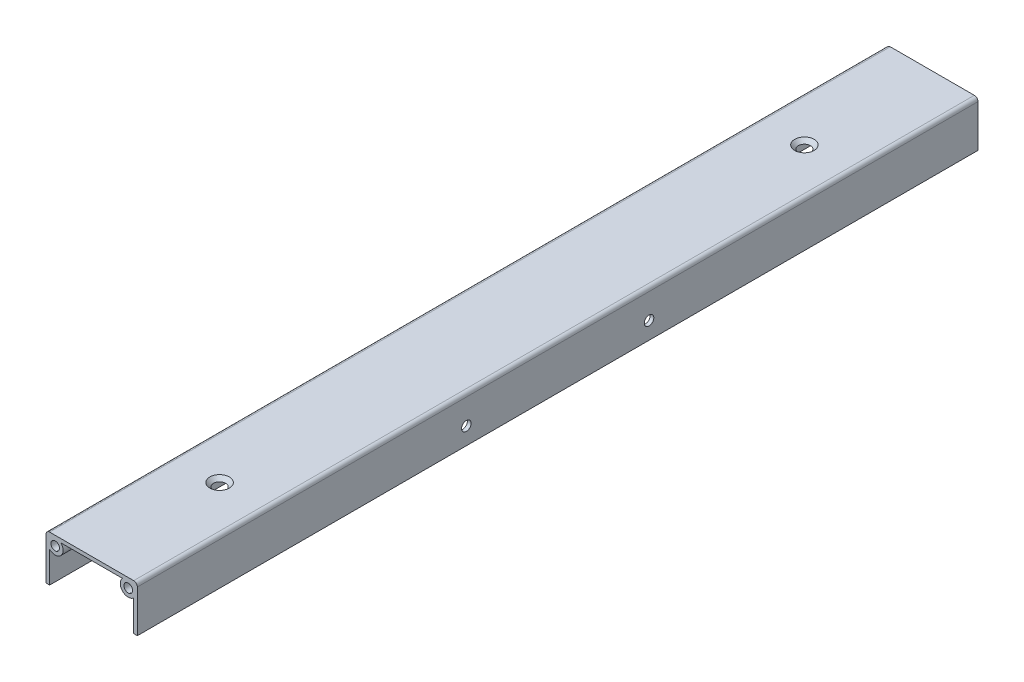
from build123d import *

# Parameters (mm, degrees)
SKETCH1_W                                            = 63.5
SKETCH1_H                                            = 63.5
SKETCH1_R                                            = 3
BOSS_EXTRUDE1_DEPTH                                  = 292.1
FILLET1_R                                            = 2.54
SHELL1_START                                         = -292.1
SHELL1_DEPTH                                         = 584.2
SKETCH3_W                                            = 63.665273771
SKETCH3_H                                            = 31.75
CUT_EXTRUDE2_DEPTH                                   = 586.923002621
CSK_FOR_M6_HEX_SOCKET_COUNTERSUNK_HEAD_S_D           = 6.4
CSK_FOR_M6_HEX_SOCKET_COUNTERSUNK_HEAD_S_CSINK_D     = 13.5
CSK_FOR_M6_HEX_SOCKET_COUNTERSUNK_HEAD_S_CSINK_ANGLE = 90
M6_CLEARANCE_HOLE1_D                                 = 6.6
M6_CLEARANCE_HOLE1_DEPTH                             = 2.54


# Read off the part's stored shape, not the designer's step: Shell1
with BuildPart() as part:
    # Sketch1 → Boss-Extrude1 (new, symmetric)
    with BuildSketch(Plane.XY):
        Rectangle(SKETCH1_W, SKETCH1_H)
        with Locations((-25.4, 25.4)):
            Circle(SKETCH1_R, mode=Mode.SUBTRACT)
        with Locations(Location((25.4, -25.4, 0), (0, 0, 180))):
            Circle(SKETCH1_R, mode=Mode.SUBTRACT)
        with Locations(Location((-25.4, -25.4, 0), (0, 0, 180))):
            Circle(SKETCH1_R, mode=Mode.SUBTRACT)
        with Locations(Location((25.4, 25.4, 0), (0, 0, 180))):
            Circle(SKETCH1_R, mode=Mode.SUBTRACT)
    extrude(amount=BOSS_EXTRUDE1_DEPTH, both=True)

    # Fillet1
    fillet1_edges = [part.edges().sort_by_distance(p)[0] for p in [
        (31.75, -31.75, 0),
        (-31.75, -31.75, 0),
        (-31.75, 31.75, 0),
        (31.75, 31.75, 0),
    ]]
    fillet(fillet1_edges, radius=FILLET1_R)

    # Shell1 outline → Shell1 (cut)
    with BuildSketch(Plane.XY.offset(SHELL1_START)):
        with BuildLine():
            Line((29.21, -21.378122329), (29.21, 21.378122329))
            ThreePointArc((29.21, 21.378122329), (21.482628432, 21.482628432), (21.378122329, 29.21))
            Line((21.378122329, 29.21), (-21.378122329, 29.21))
            ThreePointArc((-21.378122329, 29.21), (-21.482628432, 21.482628432), (-29.21, 21.378122329))
            Line((-29.21, 21.378122329), (-29.21, -21.378122329))
            ThreePointArc((-29.21, -21.378122329), (-21.482628432, -21.482628432), (-21.378122329, -29.21))
            Line((-21.378122329, -29.21), (21.378122329, -29.21))
            ThreePointArc((21.378122329, -29.21), (21.482628432, -21.482628432), (29.21, -21.378122329))
        make_face()
    extrude(amount=SHELL1_DEPTH, mode=Mode.SUBTRACT)

    # Sketch3 → Cut-Extrude2 (cut, through all)
    with BuildSketch(Plane.XY.offset(292.1)):
        with Locations((0.082636885, -16.003852467)):
            Rectangle(SKETCH3_W, SKETCH3_H)
    extrude(amount=-CUT_EXTRUDE2_DEPTH, mode=Mode.SUBTRACT)

    # CSK for M6 Hex Socket Countersunk Head Screw1 (through all)
    with Locations(Plane(origin=(0, 31.75, 0), x_dir=(1, 0, 0), z_dir=(0, 1, 0))):
        with Locations((0, 203.2), (0, -203.2)):
            CounterSinkHole(CSK_FOR_M6_HEX_SOCKET_COUNTERSUNK_HEAD_S_D / 2, CSK_FOR_M6_HEX_SOCKET_COUNTERSUNK_HEAD_S_CSINK_D / 2, counter_sink_angle=CSK_FOR_M6_HEX_SOCKET_COUNTERSUNK_HEAD_S_CSINK_ANGLE)

    # M6 Clearance Hole1
    with Locations(Plane(origin=(31.75, 0, 0), x_dir=(0, 0, -1), z_dir=(1, 0, 0))):
        with Locations((63.5, 11.811849331), (-63.5, 11.811849331)):
            Hole(M6_CLEARANCE_HOLE1_D / 2, depth=M6_CLEARANCE_HOLE1_DEPTH)


solid = part.part
